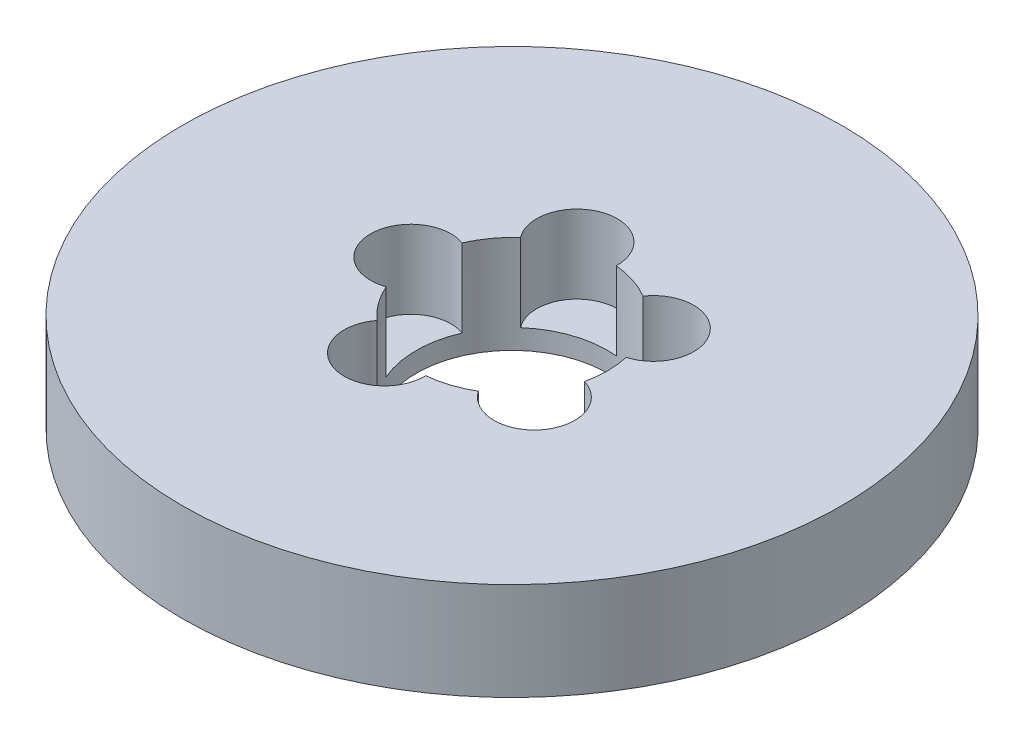
from build123d import *

# Parameters (mm, degrees)
SKETCH1_R           = 77.5
BOSS_EXTRUDE1_DEPTH = 23
SKETCH2_R           = 22.5
CUT_EXTRUDE1_DEPTH  = 112.98883873
SKETCH3_R           = 9.478491171
CUT_EXTRUDE2_DEPTH  = 18.345460798
CIRPATTERN1_COUNT   = 5


with BuildPart() as part:
    # Sketch1 → Boss-Extrude1 (new body)
    with BuildSketch(Plane(origin=(0, 0, 0), x_dir=(1, 0, 0), z_dir=(0, 1, 0))):
        Circle(SKETCH1_R)
    extrude(amount=BOSS_EXTRUDE1_DEPTH)

    # Sketch2 → Cut-Extrude1 (cut, through all)
    with BuildSketch(Plane(origin=(0, 0, 0), x_dir=(1, 0, 0), z_dir=(0, 1, 0))):
        Circle(SKETCH2_R)
    extrude(amount=CUT_EXTRUDE1_DEPTH, mode=Mode.SUBTRACT)

    # Sketch3 → Cut-Extrude2 (cut)
    with BuildSketch(Plane(origin=(0, 23, 0), x_dir=(1, 0, 0), z_dir=(0, 1, 0))):
        with Locations((-23.798715217, 0)):
            Circle(SKETCH3_R)
    cut_extrude2 = extrude(amount=-CUT_EXTRUDE2_DEPTH, mode=Mode.SUBTRACT)

    # CirPattern1: Cut-Extrude2 ×5 about axis
    cirpattern1_axis = Axis((0, 0, 0), (0, 1, 0))
    for i in range(1, CIRPATTERN1_COUNT):
        add(cut_extrude2.rotate(cirpattern1_axis, i * 360 / CIRPATTERN1_COUNT), mode=Mode.SUBTRACT)


solid = part.part
